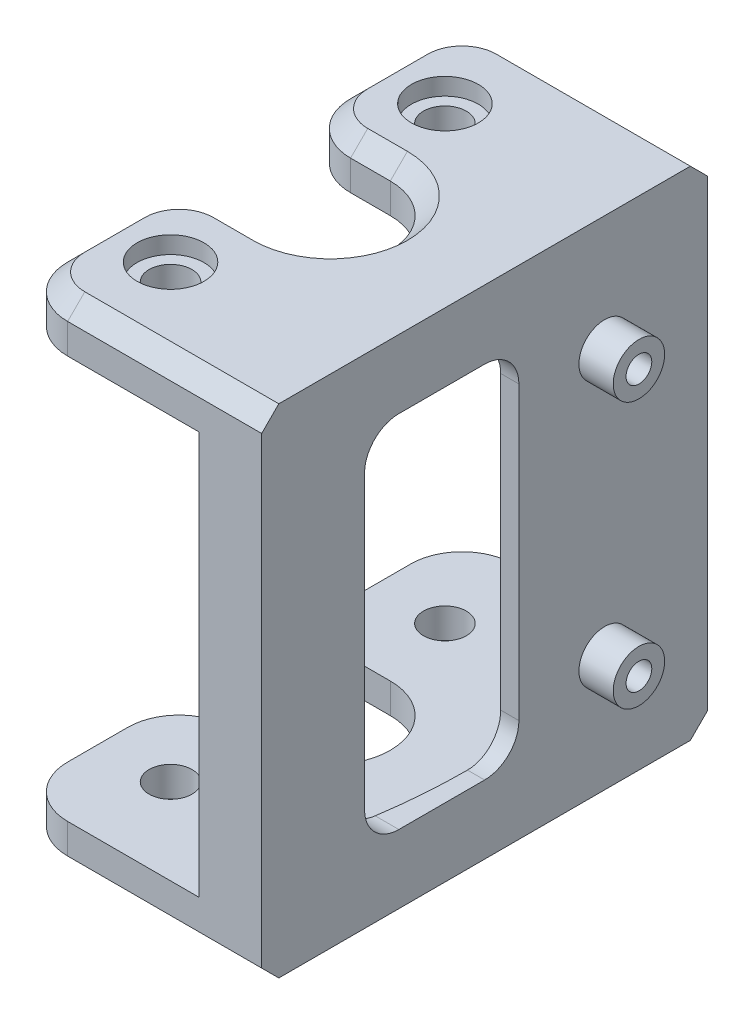
from build123d import *

# Parameters (mm, degrees)
SKETCH_1_R          = 1.25
EXTRUDE_1_DEPTH     = 14.5
SKETCH_2_R          = 33
CUT_EXTRUDE_1_DEPTH = 11.75
SKETCH_3_R          = 0.75
SKETCH_3_W          = 9
SKETCH_3_H          = 21
CUT_EXTRUDE_2_DEPTH = 25.169333236
EXTRUDE_START       = 2
SKETCH_4_R          = 1.5
SKETCH_4_R_2        = 0.75
EXTRUDE_2_DEPTH     = 2
FILLET_1_R          = 2
FILLET_2_R          = 3
CHAMFER_1_SIZE      = 1
SKETCH_5_R          = 1.95
CUT_EXTRUDE_3_DEPTH = 1


with BuildPart() as part:
    # Эскиз1 → Бобышка-Вытянуть1 (new, symmetric)
    with BuildSketch(Plane(origin=(0, 0, 0), x_dir=(1, 0, 0), z_dir=(0, 1, 0))):
        with BuildLine():
            Line((34, 13), (19.685438565, 13))
            Line((19.685438565, 13), (19.685438565, 3.5))
            Line((19.685438565, 3.5), (25, 3.5))
            ThreePointArc((25, 3.5), (27.474873734, 2.474873734), (28.5, 0))
            ThreePointArc((28.5, 0), (27.474873734, -2.474873734), (25, -3.5))
            Line((25, -3.5), (19.685438565, -3.5))
            Line((19.685438565, -3.5), (19.685438565, -13))
            Line((19.685438565, -13), (34, -13))
            Line((34, -13), (34, 13))
        make_face()
        with Locations((23.685438565, -8)):
            Circle(SKETCH_1_R, mode=Mode.SUBTRACT)
        with Locations((23.685438565, 8)):
            Circle(SKETCH_1_R, mode=Mode.SUBTRACT)
    extrude(amount=EXTRUDE_1_DEPTH, both=True)

    # Эскиз2 → Вырез-Вытянуть1 (cut, symmetric)
    with BuildSketch(Plane(origin=(0, 0, 0), x_dir=(1, 0, 0), z_dir=(0, 1, 0))):
        Circle(SKETCH_2_R)
    extrude(amount=CUT_EXTRUDE_1_DEPTH, both=True, mode=Mode.SUBTRACT)

    # Эскиз3 → Вырез-Вытянуть2 (cut, through all)
    with BuildSketch(Plane(origin=(34, 0, 0), x_dir=(0, 0, -1), z_dir=(1, 0, 0))):
        with Locations((7, 7.75)):
            Circle(SKETCH_3_R)
        with Locations((7, -7.75)):
            Circle(SKETCH_3_R)
        with Locations((-2.5, 0)):
            Rectangle(SKETCH_3_W, SKETCH_3_H)
    extrude(amount=-CUT_EXTRUDE_2_DEPTH, mode=Mode.SUBTRACT)

    # Эскиз4 → Бобышка-Вытянуть2 (add)
    # profile 1 of 2: a face of its own
    with BuildSketch(Plane(origin=(34, 0, 0), x_dir=(0, 0, -1), z_dir=(1, 0, 0)).offset(EXTRUDE_START)):
        with Locations((7, 7.75)):
            Circle(SKETCH_4_R)
        with Locations((7, 7.75)):
            Circle(SKETCH_4_R_2, mode=Mode.SUBTRACT)
    # profile 2 of 2: a face of its own
    with BuildSketch(Plane(origin=(34, 0, 0), x_dir=(0, 0, -1), z_dir=(1, 0, 0)).offset(EXTRUDE_START)):
        with Locations((7, -7.75)):
            Circle(SKETCH_4_R)
        with Locations((7, -7.75)):
            Circle(SKETCH_4_R_2, mode=Mode.SUBTRACT)
    extrude(amount=-EXTRUDE_2_DEPTH)

    # Скругление1
    fillet_1_edges = [part.edges().sort_by_distance(p)[0] for p in [
        (33.469669092, -10.5, -2),
        (33.469669092, 10.5, -2),
        (33.124515497, 10.5, 7),
        (33.124515497, -10.5, 7),
    ]]
    fillet(fillet_1_edges, radius=FILLET_1_R)

    # Скругление2
    fillet_2_edges = [part.edges().sort_by_distance(p)[0] for p in [
        (19.685438565, -13.125, -13),
        (19.685438565, -13.125, -3.5),
        (19.685438565, -13.125, 3.5),
        (19.685438565, -13.125, 13),
        (19.685438565, 13.125, -13),
        (19.685438565, 13.125, -3.5),
        (19.685438565, 13.125, 3.5),
        (19.685438565, 13.125, 13),
    ]]
    fillet(fillet_2_edges, radius=FILLET_2_R)

    # Фаска1
    chamfer_1_edges = [part.edges().sort_by_distance(p)[0] for p in [
        (28.342719282, -14.5, -13),
        (20.564118221, -14.5, -12.121320344),
        (19.685438565, -14.5, -8.25),
        (20.564118221, -14.5, -4.378679656),
        (23.842719282, -14.5, -3.5),
        (28.5, -14.5, 0),
        (23.842719282, -14.5, 3.5),
        (20.564118221, -14.5, 4.378679656),
        (19.685438565, -14.5, 8.25),
        (20.564118221, -14.5, 12.121320344),
        (28.342719282, -14.5, 13),
        (28.342719282, 14.5, -13),
        (20.564118221, 14.5, -12.121320344),
        (19.685438565, 14.5, -8.25),
        (20.564118221, 14.5, -4.378679656),
        (23.842719282, 14.5, -3.5),
        (28.5, 14.5, 0),
        (23.842719282, 14.5, 3.5),
        (20.564118221, 14.5, 4.378679656),
        (19.685438565, 14.5, 8.25),
        (20.564118221, 14.5, 12.121320344),
        (28.342719282, 14.5, 13),
    ]]
    chamfer(chamfer_1_edges, length=CHAMFER_1_SIZE)

    # Эскиз5 → Вырез-Вытянуть3 (cut)
    with BuildSketch(Plane(origin=(0, 14.5, 0), x_dir=(1, 0, 0), z_dir=(0, 1, 0))):
        with Locations((23.685438565, -8)):
            Circle(SKETCH_5_R)
        with Locations((23.685438565, 8)):
            Circle(SKETCH_5_R)
    cut_extrude_3 = extrude(amount=-CUT_EXTRUDE_3_DEPTH, mode=Mode.SUBTRACT)

    # Зеркальное отражение1: Вырез-Вытянуть3 across plane
    add(cut_extrude_3.mirror(Plane.ZX), mode=Mode.SUBTRACT)


solid = part.part
